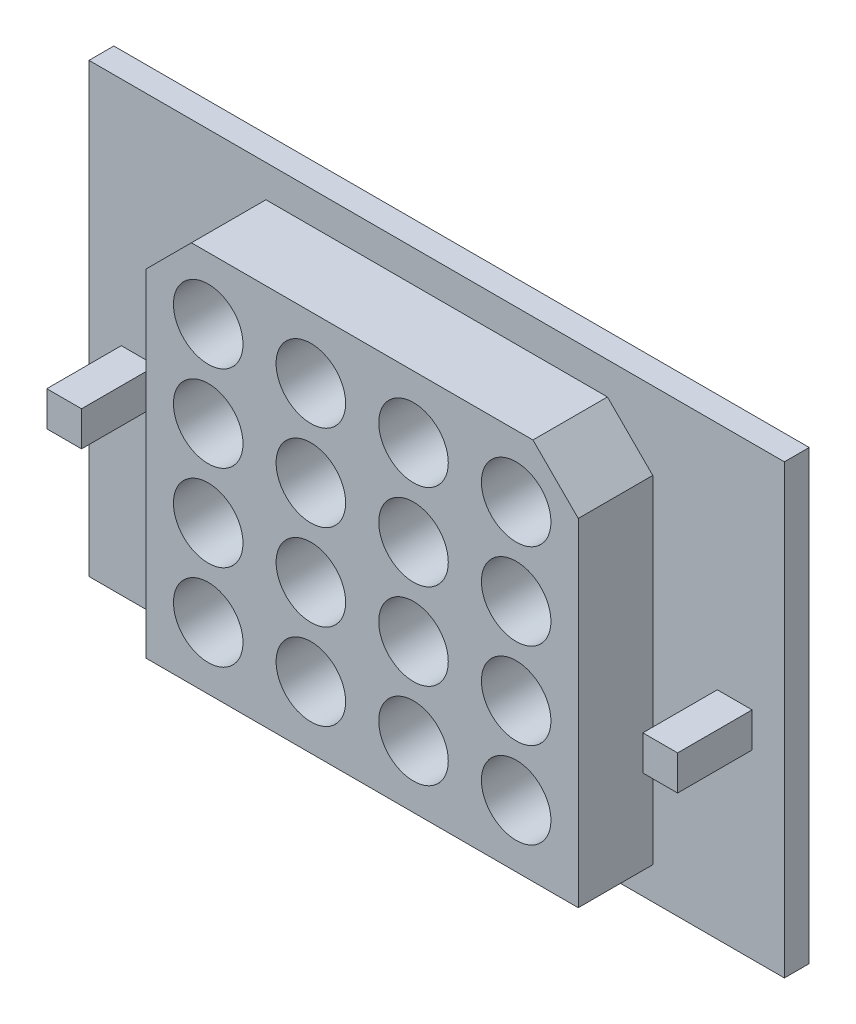
from build123d import *

# Parameters (mm, degrees)
SKETCH1_W           = 28
SKETCH1_H           = 18
BOSS_EXTRUDE1_DEPTH = 1
SKETCH2_W           = 1.4
SKETCH2_H           = 1.4
BOSS_EXTRUDE3_DEPTH = 3
SKETCH3_R           = 1.4
CUT_EXTRUDE1_DEPTH  = 10


with BuildPart() as part:
    # Sketch1 → Boss-Extrude1 (new body)
    with BuildSketch(Plane.XY):
        with Locations((-1.236641221, -1.241221374)):
            Rectangle(SKETCH1_W, SKETCH1_H)
    extrude(amount=BOSS_EXTRUDE1_DEPTH)

    # Sketch2 → Boss-Extrude3 (add)
    with BuildSketch(Plane.XY.offset(1)):
        with Locations((10.763358779, -2.241221374)):
            Rectangle(SKETCH2_W, SKETCH2_H)
        with Locations((-13.236641221, -2.241221374)):
            Rectangle(SKETCH2_W, SKETCH2_H)
        Polygon((-8.112377153, 6.458778626), (5.63909471, 6.458778626), (7.463358779, 4.634514557), (7.463358779, -8.941221374), (-9.936641221, -8.941221374), (-9.936641221, 4.634514557), align=None)
    extrude(amount=BOSS_EXTRUDE3_DEPTH)

    # Sketch3 → Cut-Extrude1 (cut)
    with BuildSketch(Plane.XY.offset(4)):
        with Locations((-7.436641221, 3.958778626)):
            Circle(SKETCH3_R)
        with Locations((-3.303307888, 3.958778626)):
            Circle(SKETCH3_R)
        with Locations((0.830025445, 3.958778626)):
            Circle(SKETCH3_R)
        with Locations((4.963358779, 3.958778626)):
            Circle(SKETCH3_R)
        with Locations((-3.303307888, 0.492111959)):
            Circle(SKETCH3_R)
        with Locations((0.830025445, 0.492111959)):
            Circle(SKETCH3_R)
        with Locations((4.963358779, 0.492111959)):
            Circle(SKETCH3_R)
        with Locations((-3.303307888, -2.974554707)):
            Circle(SKETCH3_R)
        with Locations((0.830025445, -2.974554707)):
            Circle(SKETCH3_R)
        with Locations((4.963358779, -2.974554707)):
            Circle(SKETCH3_R)
        with Locations((-3.303307888, -6.441221374)):
            Circle(SKETCH3_R)
        with Locations((0.830025445, -6.441221374)):
            Circle(SKETCH3_R)
        with Locations((4.963358779, -6.441221374)):
            Circle(SKETCH3_R)
        with Locations((-7.436641221, 0.492111959)):
            Circle(SKETCH3_R)
        with Locations((-7.436641221, -2.974554707)):
            Circle(SKETCH3_R)
        with Locations((-7.436641221, -6.441221374)):
            Circle(SKETCH3_R)
    extrude(amount=-CUT_EXTRUDE1_DEPTH, mode=Mode.SUBTRACT)


solid = part.part
